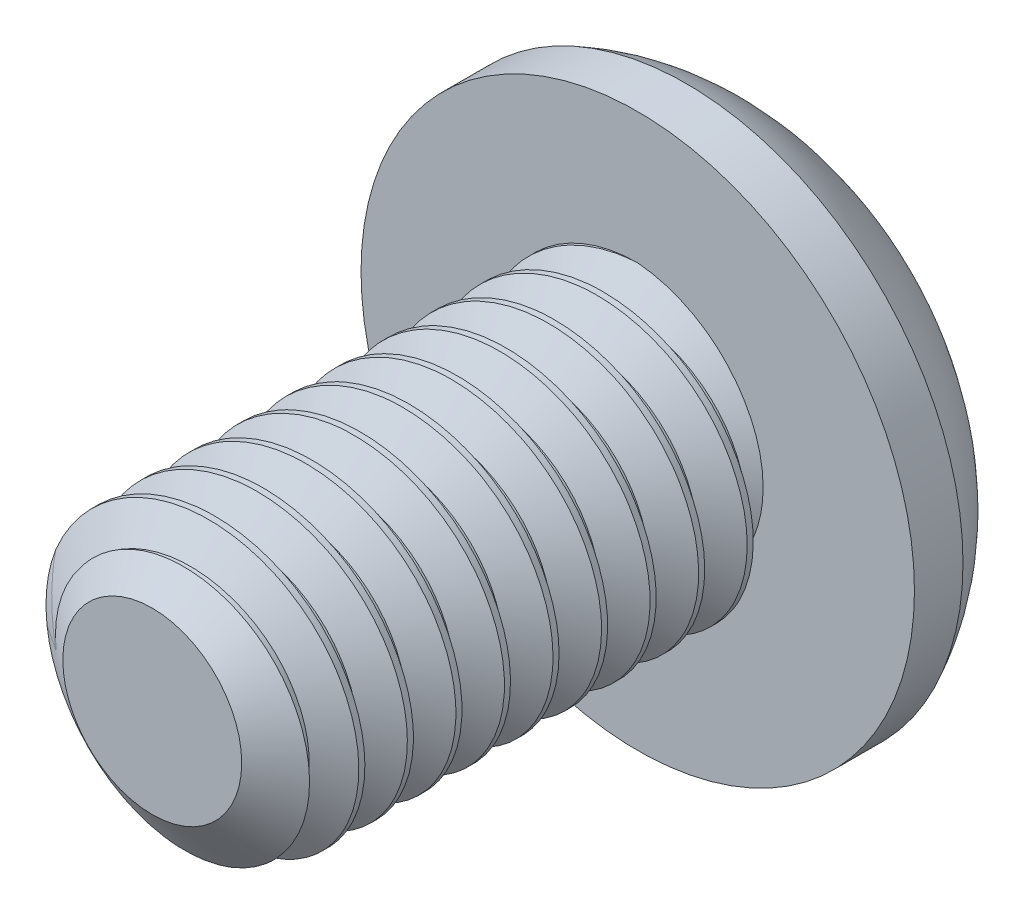
from build123d import *

# Parameters (mm, degrees)
SKETCH1_R          = 1.5
EXTRUDE1_DEPTH     = 5
CUT_SWEEP1_PITCH   = 0.5
SKETCH6_R          = 2.85
EXTRUDE2_DEPTH     = 1.65
CUT_EXTRUDE1_DEPTH = 1.5
SKETCH8_R          = 1.154700538
CUT_EXTRUDE2_DEPTH = 8.776085292
CUT_EXTRUDE2_TAPER = 45


with BuildPart() as part:
    # Sketch1 → Extrude1 (new body)
    with BuildSketch(Plane.XY):
        Circle(SKETCH1_R)
    extrude(amount=-EXTRUDE1_DEPTH)

    # Cut-Sweep1: the profile of Sketch3 profile screwed along a right-hand helix of 11 turns, 6 arcs to a turn; built about Z, then put on its axis
    cut_sweep1_z = Axis((0, 0, 0), (0, 0, 1))
    cut_sweep1_corners = [(1.5003, 0, -0.437673205), (1.175240474, 0, -0.25), (1.175240474, 0, -0.1875), (1.5003, 0, 0.000173205)]
    with BuildLine(mode=Mode.PRIVATE) as cut_sweep1_profile:
        Line(cut_sweep1_corners[0], cut_sweep1_corners[1])
        Line(cut_sweep1_corners[1], cut_sweep1_corners[2])
        Line(cut_sweep1_corners[2], cut_sweep1_corners[3])
        Line(cut_sweep1_corners[3], cut_sweep1_corners[0])
    cut_sweep1_cap = Face(cut_sweep1_profile.wire())
    cut_sweep1_turn_angles = [0, 30, 60, 90, 120, 150, 180, 210, 240, 270, 300, 330, 360]
    cut_sweep1_turn_weights = [1, 0.8660254037844387, 1, 0.8660254037844387, 1, 0.8660254037844387, 1, 0.8660254037844387, 1, 0.8660254037844387, 1, 0.8660254037844387, 1]
    cut_sweep1_turn_rails = [Edge.make_bspline([Vector(p[0], p[1], 0).rotate(cut_sweep1_z, cut_sweep1_turn_angles[k]) / cut_sweep1_turn_weights[k] + Vector(0, 0, p[2] + CUT_SWEEP1_PITCH * cut_sweep1_turn_angles[k] / 360) for k in range(13)], [0, 0, 0, 1, 1, 2, 2, 3, 3, 4, 4, 5, 5, 6, 6, 6], 2, cut_sweep1_turn_weights) for p in cut_sweep1_corners]
    cut_sweep1_turn_sides = [Face.make_surface_from_curves(cut_sweep1_turn_rails[p[0]], cut_sweep1_turn_rails[p[1]]) for p in [(0, 1), (1, 2), (2, 3), (3, 0)]]
    cut_sweep1 = Plane(origin=(0, 0, 0), x_dir=(0, 1, 0), z_dir=(0, 0, -1)) * Solid(Shell([*[p.moved(Location((0, 0, CUT_SWEEP1_PITCH * i))) for i in range(11) for p in cut_sweep1_turn_sides], cut_sweep1_cap, cut_sweep1_cap.rotate(cut_sweep1_z, 3960).moved(Location((0, 0, CUT_SWEEP1_PITCH * 3960 / 360)))]))
    add(cut_sweep1, mode=Mode.SUBTRACT)

    # Sketch4 → Cut-Revolve1 (revolve, cut)
    with BuildSketch(Plane(origin=(0, 0, 0), x_dir=(0, 0, -1), z_dir=(1, 0, 0)), mode=Mode.PRIVATE) as cut_revolve1_sk:
        Polygon((0.405251783, 1.5), (0, 0.921240474), (0, 1.5), align=None)
    revolve(cut_revolve1_sk.sketch.rotate(Axis((0, 0, 0), (0, 0, -1)), 263.352109169), axis=Axis((0, 0, 0), (0, 0, -1)), mode=Mode.SUBTRACT)

    # Sketch6 → Extrude2 (add)
    with BuildSketch(Plane(origin=(0, 0, -5), x_dir=(-1, 0, 0), z_dir=(0, 0, -1))):
        Circle(SKETCH6_R)
    extrude(amount=EXTRUDE2_DEPTH)

    # Sketch10 → Cut-Revolve2 (revolve, cut)
    with BuildSketch(Plane(origin=(0, 0, 0), x_dir=(0, 0, -1), z_dir=(1, 0, 0)), mode=Mode.PRIVATE) as cut_revolve2_sk:
        with BuildLine():
            Line((5.5, 2.85), (5.5, 3.35))
            Line((5.5, 3.35), (7.15, 3.35))
            Line((7.15, 3.35), (7.15, 1))
            Line((7.15, 1), (6.65, 1))
            ThreePointArc((6.65, 1), (6.339069073, 2.089151046), (5.5, 2.85))
        make_face()
    revolve(cut_revolve2_sk.sketch.rotate(Axis((0, 0, 0), (0, 0, -1)), 90), axis=Axis((0, 0, 0), (0, 0, -1)), mode=Mode.SUBTRACT)

    # Sketch7 → Cut-Extrude1 (cut)
    with BuildSketch(Plane(origin=(0, 0, -6.65), x_dir=(-1, 0, 0), z_dir=(0, 0, -1))):
        Polygon((0, 1.154700538), (-1, 0.577350269), (-1, -0.577350269), (0, -1.154700538), (1, -0.577350269), (1, 0.577350269), align=None)
    extrude(amount=-CUT_EXTRUDE1_DEPTH, mode=Mode.SUBTRACT)

    # Sketch8 → Cut-Extrude2 (cut, through all)
    with BuildSketch(Plane.XY.offset(-6.65)):
        Circle(SKETCH8_R)
    extrude(amount=CUT_EXTRUDE2_DEPTH, taper=CUT_EXTRUDE2_TAPER, mode=Mode.SUBTRACT)


solid = part.part
